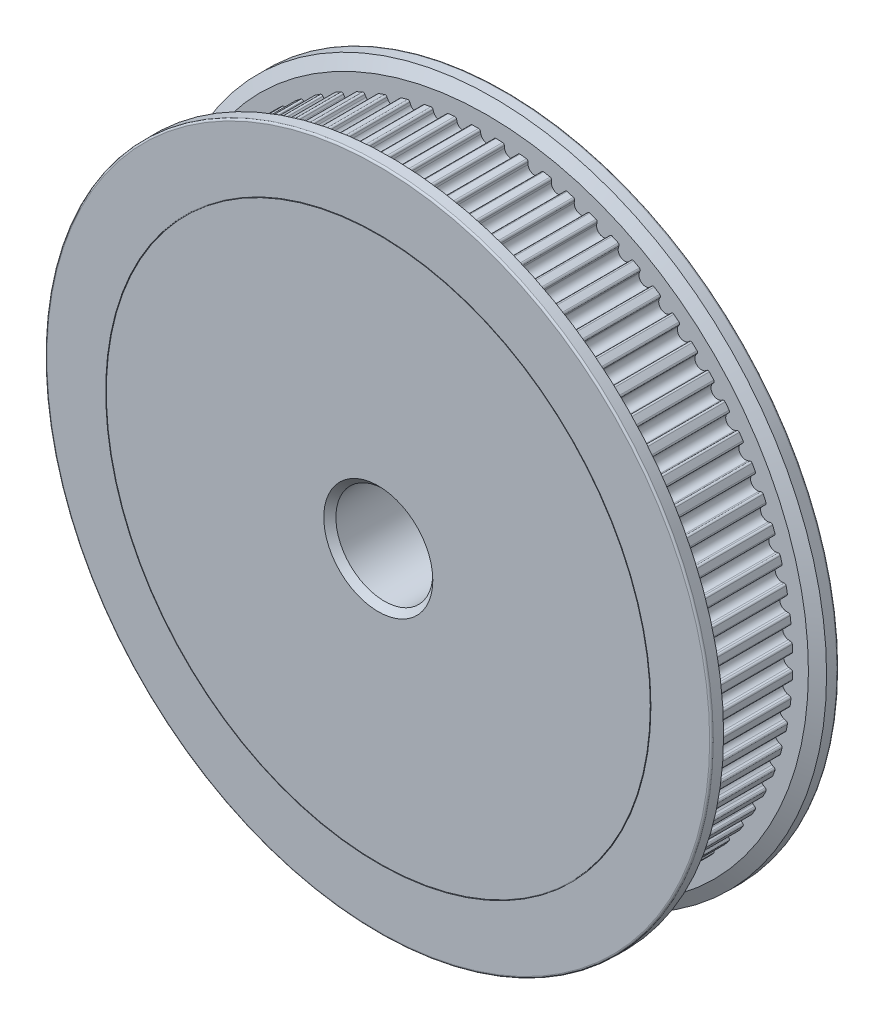
from build123d import *

# Parameters (mm, degrees)
SKETCH1_R           = 15
BOSS_EXTRUDE1_DEPTH = 6.7
SKETCH2_R           = 27.5
BOSS_EXTRUDE2_DEPTH = 1.5
SKETCH3_R           = 25.2
BOSS_EXTRUDE3_DEPTH = 7.5
SKETCH4_R           = 27.5
BOSS_EXTRUDE4_DEPTH = 1.5
CUT_EXTRUDE1_DEPTH  = 7.5
CHAMFER1_SIZE       = 0.5
CHAMFER1_SIZE2      = 1
CHAMFER2_SIZE       = 1
CHAMFER2_SIZE2      = 0.5
SKETCH7_R           = 4
CUT_EXTRUDE2_DEPTH  = 43.524581127
SKETCH8_R           = 22.5
SKETCH8_R_2         = 22.45
CUT_EXTRUDE3_DEPTH  = 0.1
CHAMFER3_SIZE       = 0.5
FILLET1_R           = 0.3
FILLET2_R           = 0.15
SKETCH10_R          = 2.15
CUT_EXTRUDE4_DEPTH  = 43.524581232
CIRPATTERN1_COUNT   = 2
CIRPATTERN1_ANGLE   = 90


with BuildPart() as part:
    # Sketch1 → Boss-Extrude1 (new body)
    with BuildSketch(Plane.XY):
        Circle(SKETCH1_R)
    extrude(amount=BOSS_EXTRUDE1_DEPTH)

    # Sketch2 → Boss-Extrude2 (add)
    with BuildSketch(Plane.XY.offset(6.7)):
        Circle(SKETCH2_R)
    extrude(amount=BOSS_EXTRUDE2_DEPTH)

    # Sketch3 → Boss-Extrude3 (add)
    with BuildSketch(Plane.XY.offset(8.2)):
        Circle(SKETCH3_R)
    extrude(amount=BOSS_EXTRUDE3_DEPTH)

    # Sketch4 → Boss-Extrude4 (add)
    with BuildSketch(Plane.XY.offset(15.7)):
        Circle(SKETCH4_R)
    extrude(amount=BOSS_EXTRUDE4_DEPTH)

    # Sketch5 → Cut-Extrude1 (cut)
    with BuildSketch(Plane.XY.offset(8.2)):
        with BuildLine():
            Line((25.189715552, 0.719882209), (25.785529714, 0.719882209))
            Line((25.785529714, 0.719882209), (25.785529714, -0.719882209))
            Line((25.785529714, -0.719882209), (25.189715552, -0.719882209))
            ThreePointArc((25.189715552, -0.719882209), (25.150400207, -0.61429342), (25.048670191, -0.565861071))
            ThreePointArc((25.048670191, -0.565861071), (24.958222291, -0.556205763), (24.869080789, -0.538099404))
            ThreePointArc((24.869080789, -0.538099404), (24.45, 0), (24.869080789, 0.538099404))
            ThreePointArc((24.869080789, 0.538099404), (24.958222291, 0.556205763), (25.048670191, 0.565861071))
            ThreePointArc((25.048670191, 0.565861071), (25.150400207, 0.61429342), (25.189715552, 0.719882209))
        make_face()
        with BuildLine():
            Line((25.168545373, -1.258699251), (25.762522838, -1.305446292))
            Line((25.762522838, -1.305446292), (25.649560224, -2.740772397))
            Line((25.649560224, -2.740772397), (25.055582759, -2.694025356))
            ThreePointArc((25.055582759, -2.694025356), (25.024673011, -2.585677416), (24.927056552, -2.529412723))
            ThreePointArc((24.927056552, -2.529412723), (24.83764502, -2.512690718), (24.75019892, -2.487646213))
            ThreePointArc((24.75019892, -2.487646213), (24.37462881, -1.918324891), (24.834636505, -1.414764968))
            ThreePointArc((24.834636505, -1.414764968), (24.924923822, -1.403708386), (25.015850448, -1.401179302))
            ThreePointArc((25.015850448, -1.401179302), (25.121066823, -1.360877899), (25.168545373, -1.258699251))
        make_face()
        with BuildLine():
            Line((24.992202742, -3.229520412), (25.580681443, -3.322726282))
            Line((25.580681443, -3.322726282), (25.355452666, -4.744764811))
            Line((25.355452666, -4.744764811), (24.766973966, -4.651558942))
            ThreePointArc((24.766973966, -4.651558942), (24.744660383, -4.541119851), (24.651759321, -4.477369704))
            ThreePointArc((24.651759321, -4.477369704), (24.563935408, -4.453684099), (24.478723845, -4.421855856))
            ThreePointArc((24.478723845, -4.421855856), (24.148979928, -3.82482267), (24.647078429, -3.358906842))
            ThreePointArc((24.647078429, -3.358906842), (24.73795491, -3.354968206), (24.828799669, -3.359580939))
            ThreePointArc((24.828799669, -3.359580939), (24.936853709, -3.327658953), (24.992202742, -3.229520412))
        make_face()
        with BuildLine():
            Line((24.661774871, -5.180430506), (25.241126639, -5.31952056))
            Line((25.241126639, -5.31952056), (24.905020311, -6.719504173))
            Line((24.905020311, -6.719504173), (24.325668542, -6.580414119))
            ThreePointArc((24.325668542, -6.580414119), (24.312088696, -6.468564772), (24.224475796, -6.397722212))
            ThreePointArc((24.224475796, -6.397722212), (24.138780966, -6.367219037), (24.056329296, -6.328803288))
            ThreePointArc((24.056329296, -6.328803288), (23.774444554, -5.707739146), (24.307562919, -5.282339939))
            ThreePointArc((24.307562919, -5.282339939), (24.398468279, -5.285543531), (24.488671083, -5.297269642))
            ThreePointArc((24.488671083, -5.297269642), (24.598896599, -5.273923883), (24.661774871, -5.180430506))
        make_face()
        with BuildLine():
            Line((24.179298956, -7.099401523), (24.745951897, -7.283518224))
            Line((24.745951897, -7.283518224), (24.301040224, -8.652815557))
            Line((24.301040224, -8.652815557), (23.734387283, -8.468698855))
            ThreePointArc((23.734387283, -8.468698855), (23.729624898, -8.35612884), (23.647840322, -8.278630635))
            ThreePointArc((23.647840322, -8.278630635), (23.564802912, -8.241497952), (23.485619479, -8.196731543))
            ThreePointArc((23.485619479, -8.196731543), (23.253331823, -7.555465512), (23.818183199, -7.173205654))
            ThreePointArc((23.818183199, -7.173205654), (23.908556978, -7.183531722), (23.997561697, -7.202298916))
            ThreePointArc((23.997561697, -7.202298916), (24.109279111, -7.187673319), (24.179298956, -7.099401523))
        make_face()
        with BuildLine():
            Line((23.547749623, -8.974602369), (24.098210132, -9.202610577))
            Line((24.098210132, -9.202610577), (23.547236143, -10.532779455))
            Line((23.547236143, -10.532779455), (22.996775634, -10.304771247))
            ThreePointArc((22.996775634, -10.304771247), (23.000860071, -10.192174595), (22.925408049, -10.108498547))
            ThreePointArc((22.925408049, -10.108498547), (22.845540012, -10.064965292), (22.770113007, -10.014124222))
            ThreePointArc((22.770113007, -10.014124222), (22.58885457, -9.356609921), (23.18195646, -9.019846171))
            ThreePointArc((23.18195646, -9.019846171), (23.271241473, -9.037231052), (23.358499363, -9.062923623))
            ThreePointArc((23.358499363, -9.062923623), (23.471019901, -9.057108359), (23.547749623, -8.974602369))
        make_face()
        with BuildLine():
            Line((22.771020583, -10.794471807), (23.301894888, -11.064965776))
            Line((23.301894888, -11.064965776), (22.648255521, -12.347805266))
            Line((22.648255521, -12.347805266), (22.117381216, -12.077311297))
            ThreePointArc((22.117381216, -12.077311297), (22.130287294, -11.965382204), (22.061633012, -11.876044204))
            ThreePointArc((22.061633012, -11.876044204), (21.985426761, -11.826378774), (21.914221217, -11.769776495))
            ThreePointArc((21.914221217, -11.769776495), (21.785109516, -11.100067719), (22.402805251, -10.810876336))
            ThreePointArc((22.402805251, -10.810876336), (22.490451026, -10.835212847), (22.575424113, -10.867672392))
            ThreePointArc((22.575424113, -10.867672392), (22.688054048, -10.870703313), (22.771020583, -10.794471807))
        make_face()
        with BuildLine():
            Line((21.85390063, -12.547789737), (22.361915714, -12.859101781))
            Line((22.361915714, -12.859101781), (21.609640872, -14.086702751))
            Line((21.609640872, -14.086702751), (21.101625787, -13.775390707))
            ThreePointArc((21.101625787, -13.775390707), (21.123273936, -13.664819253), (21.061840671, -13.5703701))
            ThreePointArc((21.061840671, -13.5703701), (20.989766043, -13.514878698), (20.923220965, -13.452864182))
            ThreePointArc((20.923220965, -13.452864182), (20.847052018, -12.775089907), (21.485533298, -12.535253854))
            ThreePointArc((21.485533298, -12.535253854), (21.570999469, -12.566391952), (21.653163866, -12.605418346))
            ThreePointArc((21.653163866, -12.605418346), (21.765208797, -12.617276767), (21.85390063, -12.547789737))
        make_face()
        with BuildLine():
            Line((20.802044111, -14.22374637), (21.284067893, -14.573957147))
            Line((21.284067893, -14.573957147), (20.437795601, -15.738751029))
            Line((20.437795601, -15.738751029), (19.955771819, -15.388540252))
            ThreePointArc((19.955771819, -15.388540252), (19.98602857, -15.280008148), (19.932195078, -15.181030151))
            ThreePointArc((19.932195078, -15.181030151), (19.864696438, -15.120054901), (19.803222099, -15.053010488))
            ThreePointArc((19.803222099, -15.053010488), (19.780465512, -14.371349419), (20.435795887, -14.182347364))
            ThreePointArc((20.435795887, -14.182347364), (20.518555527, -14.220095072), (20.597404664, -14.265447705))
            ThreePointArc((20.597404664, -14.265447705), (20.708173796, -14.286060514), (20.802044111, -14.22374637))
        make_face()
        with BuildLine():
            Line((19.621936074, -15.812008877), (20.074996716, -16.198959221))
            Line((20.074996716, -16.198959221), (19.139944525, -17.293764674))
            Line((19.139944525, -17.293764674), (18.686883882, -16.90681433))
            ThreePointArc((18.686883882, -16.90681433), (18.725562692, -16.800990711), (18.679660875, -16.698094103))
            ThreePointArc((18.679660875, -16.698094103), (18.617154374, -16.632010937), (18.561129784, -16.560349979))
            ThreePointArc((18.561129784, -16.560349979), (18.591925859, -15.879004782), (19.260064999, -15.742001986))
            ThreePointArc((19.260064999, -15.742001986), (19.339607868, -15.786126577), (19.414655612, -15.837525834))
            ThreePointArc((19.414655612, -15.837525834), (19.523466018, -15.866765948), (19.621936074, -15.812008877))
        make_face()
        with BuildLine():
            Line((18.320852275, -17.302785091), (18.742156509, -17.724089325))
            Line((18.742156509, -17.724089325), (17.724089325, -18.742156509))
            Line((17.724089325, -18.742156509), (17.302785091, -18.320852275))
            ThreePointArc((17.302785091, -18.320852275), (17.349647493, -18.218389579), (17.311960351, -18.112208753))
            ThreePointArc((17.311960351, -18.112208753), (17.254831362, -18.041425095), (17.204601931, -17.965589405))
            ThreePointArc((17.204601931, -17.965589405), (17.2887608, -17.2887608), (17.965589405, -17.204601931))
            ThreePointArc((17.965589405, -17.204601931), (18.041425095, -17.254831362), (18.112208753, -17.311960351))
            ThreePointArc((18.112208753, -17.311960351), (18.218389579, -17.349647493), (18.320852275, -17.302785091))
        make_face()
        with BuildLine():
            Line((16.90681433, -18.686883882), (17.293764674, -19.139944525))
            Line((17.293764674, -19.139944525), (16.198959221, -20.074996716))
            Line((16.198959221, -20.074996716), (15.812008877, -19.621936074))
            ThreePointArc((15.812008877, -19.621936074), (15.866765948, -19.523466018), (15.837525834, -19.414655612))
            ThreePointArc((15.837525834, -19.414655612), (15.786126577, -19.339607868), (15.742001986, -19.260064999))
            ThreePointArc((15.742001986, -19.260064999), (15.879004782, -18.591925859), (16.560349979, -18.561129784))
            ThreePointArc((16.560349979, -18.561129784), (16.632010937, -18.617154374), (16.698094103, -18.679660875))
            ThreePointArc((16.698094103, -18.679660875), (16.800990711, -18.725562692), (16.90681433, -18.686883882))
        make_face()
        with BuildLine():
            Line((15.388540252, -19.955771819), (15.738751029, -20.437795601))
            Line((15.738751029, -20.437795601), (14.573957147, -21.284067893))
            Line((14.573957147, -21.284067893), (14.22374637, -20.802044111))
            ThreePointArc((14.22374637, -20.802044111), (14.286060514, -20.708173796), (14.265447705, -20.597404664))
            ThreePointArc((14.265447705, -20.597404664), (14.220095072, -20.518555527), (14.182347364, -20.435795887))
            ThreePointArc((14.182347364, -20.435795887), (14.371349419, -19.780465512), (15.053010488, -19.803222099))
            ThreePointArc((15.053010488, -19.803222099), (15.120054901, -19.864696438), (15.181030151, -19.932195078))
            ThreePointArc((15.181030151, -19.932195078), (15.280008148, -19.98602857), (15.388540252, -19.955771819))
        make_face()
        with BuildLine():
            Line((13.775390707, -21.101625787), (14.086702751, -21.609640872))
            Line((14.086702751, -21.609640872), (12.859101781, -22.361915714))
            Line((12.859101781, -22.361915714), (12.547789737, -21.85390063))
            ThreePointArc((12.547789737, -21.85390063), (12.617276767, -21.765208797), (12.605418346, -21.653163866))
            ThreePointArc((12.605418346, -21.653163866), (12.566391952, -21.570999469), (12.535253854, -21.485533298))
            ThreePointArc((12.535253854, -21.485533298), (12.775089907, -20.847052018), (13.452864182, -20.923220965))
            ThreePointArc((13.452864182, -20.923220965), (13.514878698, -20.989766043), (13.5703701, -21.061840671))
            ThreePointArc((13.5703701, -21.061840671), (13.664819253, -21.123273936), (13.775390707, -21.101625787))
        make_face()
        with BuildLine():
            Line((12.077311297, -22.117381216), (12.347805266, -22.648255521))
            Line((12.347805266, -22.648255521), (11.064965776, -23.301894888))
            Line((11.064965776, -23.301894888), (10.794471807, -22.771020583))
            ThreePointArc((10.794471807, -22.771020583), (10.870703313, -22.688054048), (10.867672392, -22.575424113))
            ThreePointArc((10.867672392, -22.575424113), (10.835212847, -22.490451026), (10.810876336, -22.402805251))
            ThreePointArc((10.810876336, -22.402805251), (11.100067719, -21.785109516), (11.769776495, -21.914221217))
            ThreePointArc((11.769776495, -21.914221217), (11.826378774, -21.985426761), (11.876044204, -22.061633012))
            ThreePointArc((11.876044204, -22.061633012), (11.965382204, -22.130287294), (12.077311297, -22.117381216))
        make_face()
        with BuildLine():
            Line((10.304771247, -22.996775634), (10.532779455, -23.547236143))
            Line((10.532779455, -23.547236143), (9.202610577, -24.098210132))
            Line((9.202610577, -24.098210132), (8.974602369, -23.547749623))
            ThreePointArc((8.974602369, -23.547749623), (9.057108359, -23.471019901), (9.062923623, -23.358499363))
            ThreePointArc((9.062923623, -23.358499363), (9.037231052, -23.271241473), (9.019846171, -23.18195646))
            ThreePointArc((9.019846171, -23.18195646), (9.356609921, -22.58885457), (10.014124222, -22.770113007))
            ThreePointArc((10.014124222, -22.770113007), (10.064965292, -22.845540012), (10.108498547, -22.925408049))
            ThreePointArc((10.108498547, -22.925408049), (10.192174595, -23.000860071), (10.304771247, -22.996775634))
        make_face()
        with BuildLine():
            Line((8.468698855, -23.734387283), (8.652815557, -24.301040224))
            Line((8.652815557, -24.301040224), (7.283518224, -24.745951897))
            Line((7.283518224, -24.745951897), (7.099401523, -24.179298956))
            ThreePointArc((7.099401523, -24.179298956), (7.187673319, -24.109279111), (7.202298916, -23.997561697))
            ThreePointArc((7.202298916, -23.997561697), (7.183531722, -23.908556978), (7.173205654, -23.818183199))
            ThreePointArc((7.173205654, -23.818183199), (7.555465512, -23.253331823), (8.196731543, -23.485619479))
            ThreePointArc((8.196731543, -23.485619479), (8.241497952, -23.564802912), (8.278630635, -23.647840322))
            ThreePointArc((8.278630635, -23.647840322), (8.35612884, -23.729624898), (8.468698855, -23.734387283))
        make_face()
        with BuildLine():
            Line((6.580414119, -24.325668542), (6.719504173, -24.905020311))
            Line((6.719504173, -24.905020311), (5.31952056, -25.241126639))
            Line((5.31952056, -25.241126639), (5.180430506, -24.661774871))
            ThreePointArc((5.180430506, -24.661774871), (5.273923883, -24.598896599), (5.297269642, -24.488671083))
            ThreePointArc((5.297269642, -24.488671083), (5.285543531, -24.398468279), (5.282339939, -24.307562919))
            ThreePointArc((5.282339939, -24.307562919), (5.707739146, -23.774444554), (6.328803288, -24.056329296))
            ThreePointArc((6.328803288, -24.056329296), (6.367219037, -24.138780966), (6.397722212, -24.224475796))
            ThreePointArc((6.397722212, -24.224475796), (6.468564772, -24.312088696), (6.580414119, -24.325668542))
        make_face()
        with BuildLine():
            Line((4.651558942, -24.766973966), (4.744764811, -25.355452666))
            Line((4.744764811, -25.355452666), (3.322726282, -25.580681443))
            Line((3.322726282, -25.580681443), (3.229520412, -24.992202742))
            ThreePointArc((3.229520412, -24.992202742), (3.327658953, -24.936853709), (3.359580939, -24.828799669))
            ThreePointArc((3.359580939, -24.828799669), (3.354968206, -24.73795491), (3.358906842, -24.647078429))
            ThreePointArc((3.358906842, -24.647078429), (3.82482267, -24.148979928), (4.421855856, -24.478723845))
            ThreePointArc((4.421855856, -24.478723845), (4.453684099, -24.563935408), (4.477369704, -24.651759321))
            ThreePointArc((4.477369704, -24.651759321), (4.541119851, -24.744660383), (4.651558942, -24.766973966))
        make_face()
        with BuildLine():
            Line((2.694025356, -25.055582759), (2.740772397, -25.649560224))
            Line((2.740772397, -25.649560224), (1.305446292, -25.762522838))
            Line((1.305446292, -25.762522838), (1.258699251, -25.168545373))
            ThreePointArc((1.258699251, -25.168545373), (1.360877899, -25.121066823), (1.401179302, -25.015850448))
            ThreePointArc((1.401179302, -25.015850448), (1.403708386, -24.924923822), (1.414764968, -24.834636505))
            ThreePointArc((1.414764968, -24.834636505), (1.918324891, -24.37462881), (2.487646213, -24.75019892))
            ThreePointArc((2.487646213, -24.75019892), (2.512690718, -24.83764502), (2.529412723, -24.927056552))
            ThreePointArc((2.529412723, -24.927056552), (2.585677416, -25.024673011), (2.694025356, -25.055582759))
        make_face()
        with BuildLine():
            Line((0.719882209, -25.189715552), (0.719882209, -25.785529714))
            Line((0.719882209, -25.785529714), (-0.719882209, -25.785529714))
            Line((-0.719882209, -25.785529714), (-0.719882209, -25.189715552))
            ThreePointArc((-0.719882209, -25.189715552), (-0.61429342, -25.150400207), (-0.565861071, -25.048670191))
            ThreePointArc((-0.565861071, -25.048670191), (-0.556205763, -24.958222291), (-0.538099404, -24.869080789))
            ThreePointArc((-0.538099404, -24.869080789), (0, -24.45), (0.538099404, -24.869080789))
            ThreePointArc((0.538099404, -24.869080789), (0.556205763, -24.958222291), (0.565861071, -25.048670191))
            ThreePointArc((0.565861071, -25.048670191), (0.61429342, -25.150400207), (0.719882209, -25.189715552))
        make_face()
        with BuildLine():
            Line((-1.258699251, -25.168545373), (-1.305446292, -25.762522838))
            Line((-1.305446292, -25.762522838), (-2.740772397, -25.649560224))
            Line((-2.740772397, -25.649560224), (-2.694025356, -25.055582759))
            ThreePointArc((-2.694025356, -25.055582759), (-2.585677416, -25.024673011), (-2.529412723, -24.927056552))
            ThreePointArc((-2.529412723, -24.927056552), (-2.512690718, -24.83764502), (-2.487646213, -24.75019892))
            ThreePointArc((-2.487646213, -24.75019892), (-1.918324891, -24.37462881), (-1.414764968, -24.834636505))
            ThreePointArc((-1.414764968, -24.834636505), (-1.403708386, -24.924923822), (-1.401179302, -25.015850448))
            ThreePointArc((-1.401179302, -25.015850448), (-1.360877899, -25.121066823), (-1.258699251, -25.168545373))
        make_face()
        with BuildLine():
            Line((-3.229520412, -24.992202742), (-3.322726282, -25.580681443))
            Line((-3.322726282, -25.580681443), (-4.744764811, -25.355452666))
            Line((-4.744764811, -25.355452666), (-4.651558942, -24.766973966))
            ThreePointArc((-4.651558942, -24.766973966), (-4.541119851, -24.744660383), (-4.477369704, -24.651759321))
            ThreePointArc((-4.477369704, -24.651759321), (-4.453684099, -24.563935408), (-4.421855856, -24.478723845))
            ThreePointArc((-4.421855856, -24.478723845), (-3.82482267, -24.148979928), (-3.358906842, -24.647078429))
            ThreePointArc((-3.358906842, -24.647078429), (-3.354968206, -24.73795491), (-3.359580939, -24.828799669))
            ThreePointArc((-3.359580939, -24.828799669), (-3.327658953, -24.936853709), (-3.229520412, -24.992202742))
        make_face()
        with BuildLine():
            Line((-5.180430506, -24.661774871), (-5.31952056, -25.241126639))
            Line((-5.31952056, -25.241126639), (-6.719504173, -24.905020311))
            Line((-6.719504173, -24.905020311), (-6.580414119, -24.325668542))
            ThreePointArc((-6.580414119, -24.325668542), (-6.468564772, -24.312088696), (-6.397722212, -24.224475796))
            ThreePointArc((-6.397722212, -24.224475796), (-6.367219037, -24.138780966), (-6.328803288, -24.056329296))
            ThreePointArc((-6.328803288, -24.056329296), (-5.707739146, -23.774444554), (-5.282339939, -24.307562919))
            ThreePointArc((-5.282339939, -24.307562919), (-5.285543531, -24.398468279), (-5.297269642, -24.488671083))
            ThreePointArc((-5.297269642, -24.488671083), (-5.273923883, -24.598896599), (-5.180430506, -24.661774871))
        make_face()
        with BuildLine():
            Line((-7.099401523, -24.179298956), (-7.283518224, -24.745951897))
            Line((-7.283518224, -24.745951897), (-8.652815557, -24.301040224))
            Line((-8.652815557, -24.301040224), (-8.468698855, -23.734387283))
            ThreePointArc((-8.468698855, -23.734387283), (-8.35612884, -23.729624898), (-8.278630635, -23.647840322))
            ThreePointArc((-8.278630635, -23.647840322), (-8.241497952, -23.564802912), (-8.196731543, -23.485619479))
            ThreePointArc((-8.196731543, -23.485619479), (-7.555465512, -23.253331823), (-7.173205654, -23.818183199))
            ThreePointArc((-7.173205654, -23.818183199), (-7.183531722, -23.908556978), (-7.202298916, -23.997561697))
            ThreePointArc((-7.202298916, -23.997561697), (-7.187673319, -24.109279111), (-7.099401523, -24.179298956))
        make_face()
        with BuildLine():
            Line((-8.974602369, -23.547749623), (-9.202610577, -24.098210132))
            Line((-9.202610577, -24.098210132), (-10.532779455, -23.547236143))
            Line((-10.532779455, -23.547236143), (-10.304771247, -22.996775634))
            ThreePointArc((-10.304771247, -22.996775634), (-10.192174595, -23.000860071), (-10.108498547, -22.925408049))
            ThreePointArc((-10.108498547, -22.925408049), (-10.064965292, -22.845540012), (-10.014124222, -22.770113007))
            ThreePointArc((-10.014124222, -22.770113007), (-9.356609921, -22.58885457), (-9.019846171, -23.18195646))
            ThreePointArc((-9.019846171, -23.18195646), (-9.037231052, -23.271241473), (-9.062923623, -23.358499363))
            ThreePointArc((-9.062923623, -23.358499363), (-9.057108359, -23.471019901), (-8.974602369, -23.547749623))
        make_face()
        with BuildLine():
            Line((-10.794471807, -22.771020583), (-11.064965776, -23.301894888))
            Line((-11.064965776, -23.301894888), (-12.347805266, -22.648255521))
            Line((-12.347805266, -22.648255521), (-12.077311297, -22.117381216))
            ThreePointArc((-12.077311297, -22.117381216), (-11.965382204, -22.130287294), (-11.876044204, -22.061633012))
            ThreePointArc((-11.876044204, -22.061633012), (-11.826378774, -21.985426761), (-11.769776495, -21.914221217))
            ThreePointArc((-11.769776495, -21.914221217), (-11.100067719, -21.785109516), (-10.810876336, -22.402805251))
            ThreePointArc((-10.810876336, -22.402805251), (-10.835212847, -22.490451026), (-10.867672392, -22.575424113))
            ThreePointArc((-10.867672392, -22.575424113), (-10.870703313, -22.688054048), (-10.794471807, -22.771020583))
        make_face()
        with BuildLine():
            Line((-12.547789737, -21.85390063), (-12.859101781, -22.361915714))
            Line((-12.859101781, -22.361915714), (-14.086702751, -21.609640872))
            Line((-14.086702751, -21.609640872), (-13.775390707, -21.101625787))
            ThreePointArc((-13.775390707, -21.101625787), (-13.664819253, -21.123273936), (-13.5703701, -21.061840671))
            ThreePointArc((-13.5703701, -21.061840671), (-13.514878698, -20.989766043), (-13.452864182, -20.923220965))
            ThreePointArc((-13.452864182, -20.923220965), (-12.775089907, -20.847052018), (-12.535253854, -21.485533298))
            ThreePointArc((-12.535253854, -21.485533298), (-12.566391952, -21.570999469), (-12.605418346, -21.653163866))
            ThreePointArc((-12.605418346, -21.653163866), (-12.617276767, -21.765208797), (-12.547789737, -21.85390063))
        make_face()
        with BuildLine():
            Line((-14.22374637, -20.802044111), (-14.573957147, -21.284067893))
            Line((-14.573957147, -21.284067893), (-15.738751029, -20.437795601))
            Line((-15.738751029, -20.437795601), (-15.388540252, -19.955771819))
            ThreePointArc((-15.388540252, -19.955771819), (-15.280008148, -19.98602857), (-15.181030151, -19.932195078))
            ThreePointArc((-15.181030151, -19.932195078), (-15.120054901, -19.864696438), (-15.053010488, -19.803222099))
            ThreePointArc((-15.053010488, -19.803222099), (-14.371349419, -19.780465512), (-14.182347364, -20.435795887))
            ThreePointArc((-14.182347364, -20.435795887), (-14.220095072, -20.518555527), (-14.265447705, -20.597404664))
            ThreePointArc((-14.265447705, -20.597404664), (-14.286060514, -20.708173796), (-14.22374637, -20.802044111))
        make_face()
        with BuildLine():
            Line((-15.812008877, -19.621936074), (-16.198959221, -20.074996716))
            Line((-16.198959221, -20.074996716), (-17.293764674, -19.139944525))
            Line((-17.293764674, -19.139944525), (-16.90681433, -18.686883882))
            ThreePointArc((-16.90681433, -18.686883882), (-16.800990711, -18.725562692), (-16.698094103, -18.679660875))
            ThreePointArc((-16.698094103, -18.679660875), (-16.632010937, -18.617154374), (-16.560349979, -18.561129784))
            ThreePointArc((-16.560349979, -18.561129784), (-15.879004782, -18.591925859), (-15.742001986, -19.260064999))
            ThreePointArc((-15.742001986, -19.260064999), (-15.786126577, -19.339607868), (-15.837525834, -19.414655612))
            ThreePointArc((-15.837525834, -19.414655612), (-15.866765948, -19.523466018), (-15.812008877, -19.621936074))
        make_face()
        with BuildLine():
            Line((-17.302785091, -18.320852275), (-17.724089325, -18.742156509))
            Line((-17.724089325, -18.742156509), (-18.742156509, -17.724089325))
            Line((-18.742156509, -17.724089325), (-18.320852275, -17.302785091))
            ThreePointArc((-18.320852275, -17.302785091), (-18.218389579, -17.349647493), (-18.112208753, -17.311960351))
            ThreePointArc((-18.112208753, -17.311960351), (-18.041425095, -17.254831362), (-17.965589405, -17.204601931))
            ThreePointArc((-17.965589405, -17.204601931), (-17.2887608, -17.2887608), (-17.204601931, -17.965589405))
            ThreePointArc((-17.204601931, -17.965589405), (-17.254831362, -18.041425095), (-17.311960351, -18.112208753))
            ThreePointArc((-17.311960351, -18.112208753), (-17.349647493, -18.218389579), (-17.302785091, -18.320852275))
        make_face()
        with BuildLine():
            Line((-18.686883882, -16.90681433), (-19.139944525, -17.293764674))
            Line((-19.139944525, -17.293764674), (-20.074996716, -16.198959221))
            Line((-20.074996716, -16.198959221), (-19.621936074, -15.812008877))
            ThreePointArc((-19.621936074, -15.812008877), (-19.523466018, -15.866765948), (-19.414655612, -15.837525834))
            ThreePointArc((-19.414655612, -15.837525834), (-19.339607868, -15.786126577), (-19.260064999, -15.742001986))
            ThreePointArc((-19.260064999, -15.742001986), (-18.591925859, -15.879004782), (-18.561129784, -16.560349979))
            ThreePointArc((-18.561129784, -16.560349979), (-18.617154374, -16.632010937), (-18.679660875, -16.698094103))
            ThreePointArc((-18.679660875, -16.698094103), (-18.725562692, -16.800990711), (-18.686883882, -16.90681433))
        make_face()
        with BuildLine():
            Line((-19.955771819, -15.388540252), (-20.437795601, -15.738751029))
            Line((-20.437795601, -15.738751029), (-21.284067893, -14.573957147))
            Line((-21.284067893, -14.573957147), (-20.802044111, -14.22374637))
            ThreePointArc((-20.802044111, -14.22374637), (-20.708173796, -14.286060514), (-20.597404664, -14.265447705))
            ThreePointArc((-20.597404664, -14.265447705), (-20.518555527, -14.220095072), (-20.435795887, -14.182347364))
            ThreePointArc((-20.435795887, -14.182347364), (-19.780465512, -14.371349419), (-19.803222099, -15.053010488))
            ThreePointArc((-19.803222099, -15.053010488), (-19.864696438, -15.120054901), (-19.932195078, -15.181030151))
            ThreePointArc((-19.932195078, -15.181030151), (-19.98602857, -15.280008148), (-19.955771819, -15.388540252))
        make_face()
        with BuildLine():
            Line((-21.101625787, -13.775390707), (-21.609640872, -14.086702751))
            Line((-21.609640872, -14.086702751), (-22.361915714, -12.859101781))
            Line((-22.361915714, -12.859101781), (-21.85390063, -12.547789737))
            ThreePointArc((-21.85390063, -12.547789737), (-21.765208797, -12.617276767), (-21.653163866, -12.605418346))
            ThreePointArc((-21.653163866, -12.605418346), (-21.570999469, -12.566391952), (-21.485533298, -12.535253854))
            ThreePointArc((-21.485533298, -12.535253854), (-20.847052018, -12.775089907), (-20.923220965, -13.452864182))
            ThreePointArc((-20.923220965, -13.452864182), (-20.989766043, -13.514878698), (-21.061840671, -13.5703701))
            ThreePointArc((-21.061840671, -13.5703701), (-21.123273936, -13.664819253), (-21.101625787, -13.775390707))
        make_face()
        with BuildLine():
            Line((-22.117381216, -12.077311297), (-22.648255521, -12.347805266))
            Line((-22.648255521, -12.347805266), (-23.301894888, -11.064965776))
            Line((-23.301894888, -11.064965776), (-22.771020583, -10.794471807))
            ThreePointArc((-22.771020583, -10.794471807), (-22.688054048, -10.870703313), (-22.575424113, -10.867672392))
            ThreePointArc((-22.575424113, -10.867672392), (-22.490451026, -10.835212847), (-22.402805251, -10.810876336))
            ThreePointArc((-22.402805251, -10.810876336), (-21.785109516, -11.100067719), (-21.914221217, -11.769776495))
            ThreePointArc((-21.914221217, -11.769776495), (-21.985426761, -11.826378774), (-22.061633012, -11.876044204))
            ThreePointArc((-22.061633012, -11.876044204), (-22.130287294, -11.965382204), (-22.117381216, -12.077311297))
        make_face()
        with BuildLine():
            Line((-22.996775634, -10.304771247), (-23.547236143, -10.532779455))
            Line((-23.547236143, -10.532779455), (-24.098210132, -9.202610577))
            Line((-24.098210132, -9.202610577), (-23.547749623, -8.974602369))
            ThreePointArc((-23.547749623, -8.974602369), (-23.471019901, -9.057108359), (-23.358499363, -9.062923623))
            ThreePointArc((-23.358499363, -9.062923623), (-23.271241473, -9.037231052), (-23.18195646, -9.019846171))
            ThreePointArc((-23.18195646, -9.019846171), (-22.58885457, -9.356609921), (-22.770113007, -10.014124222))
            ThreePointArc((-22.770113007, -10.014124222), (-22.845540012, -10.064965292), (-22.925408049, -10.108498547))
            ThreePointArc((-22.925408049, -10.108498547), (-23.000860071, -10.192174595), (-22.996775634, -10.304771247))
        make_face()
        with BuildLine():
            Line((-23.734387283, -8.468698855), (-24.301040224, -8.652815557))
            Line((-24.301040224, -8.652815557), (-24.745951897, -7.283518224))
            Line((-24.745951897, -7.283518224), (-24.179298956, -7.099401523))
            ThreePointArc((-24.179298956, -7.099401523), (-24.109279111, -7.187673319), (-23.997561697, -7.202298916))
            ThreePointArc((-23.997561697, -7.202298916), (-23.908556978, -7.183531722), (-23.818183199, -7.173205654))
            ThreePointArc((-23.818183199, -7.173205654), (-23.253331823, -7.555465512), (-23.485619479, -8.196731543))
            ThreePointArc((-23.485619479, -8.196731543), (-23.564802912, -8.241497952), (-23.647840322, -8.278630635))
            ThreePointArc((-23.647840322, -8.278630635), (-23.729624898, -8.35612884), (-23.734387283, -8.468698855))
        make_face()
        with BuildLine():
            Line((-24.325668542, -6.580414119), (-24.905020311, -6.719504173))
            Line((-24.905020311, -6.719504173), (-25.241126639, -5.31952056))
            Line((-25.241126639, -5.31952056), (-24.661774871, -5.180430506))
            ThreePointArc((-24.661774871, -5.180430506), (-24.598896599, -5.273923883), (-24.488671083, -5.297269642))
            ThreePointArc((-24.488671083, -5.297269642), (-24.398468279, -5.285543531), (-24.307562919, -5.282339939))
            ThreePointArc((-24.307562919, -5.282339939), (-23.774444554, -5.707739146), (-24.056329296, -6.328803288))
            ThreePointArc((-24.056329296, -6.328803288), (-24.138780966, -6.367219037), (-24.224475796, -6.397722212))
            ThreePointArc((-24.224475796, -6.397722212), (-24.312088696, -6.468564772), (-24.325668542, -6.580414119))
        make_face()
        with BuildLine():
            Line((-24.766973966, -4.651558942), (-25.355452666, -4.744764811))
            Line((-25.355452666, -4.744764811), (-25.580681443, -3.322726282))
            Line((-25.580681443, -3.322726282), (-24.992202742, -3.229520412))
            ThreePointArc((-24.992202742, -3.229520412), (-24.936853709, -3.327658953), (-24.828799669, -3.359580939))
            ThreePointArc((-24.828799669, -3.359580939), (-24.73795491, -3.354968206), (-24.647078429, -3.358906842))
            ThreePointArc((-24.647078429, -3.358906842), (-24.148979928, -3.82482267), (-24.478723845, -4.421855856))
            ThreePointArc((-24.478723845, -4.421855856), (-24.563935408, -4.453684099), (-24.651759321, -4.477369704))
            ThreePointArc((-24.651759321, -4.477369704), (-24.744660383, -4.541119851), (-24.766973966, -4.651558942))
        make_face()
        with BuildLine():
            Line((-25.055582759, -2.694025356), (-25.649560224, -2.740772397))
            Line((-25.649560224, -2.740772397), (-25.762522838, -1.305446292))
            Line((-25.762522838, -1.305446292), (-25.168545373, -1.258699251))
            ThreePointArc((-25.168545373, -1.258699251), (-25.121066823, -1.360877899), (-25.015850448, -1.401179302))
            ThreePointArc((-25.015850448, -1.401179302), (-24.924923822, -1.403708386), (-24.834636505, -1.414764968))
            ThreePointArc((-24.834636505, -1.414764968), (-24.37462881, -1.918324891), (-24.75019892, -2.487646213))
            ThreePointArc((-24.75019892, -2.487646213), (-24.83764502, -2.512690718), (-24.927056552, -2.529412723))
            ThreePointArc((-24.927056552, -2.529412723), (-25.024673011, -2.585677416), (-25.055582759, -2.694025356))
        make_face()
        with BuildLine():
            Line((-25.189715552, -0.719882209), (-25.785529714, -0.719882209))
            Line((-25.785529714, -0.719882209), (-25.785529714, 0.719882209))
            Line((-25.785529714, 0.719882209), (-25.189715552, 0.719882209))
            ThreePointArc((-25.189715552, 0.719882209), (-25.150400207, 0.61429342), (-25.048670191, 0.565861071))
            ThreePointArc((-25.048670191, 0.565861071), (-24.958222291, 0.556205763), (-24.869080789, 0.538099404))
            ThreePointArc((-24.869080789, 0.538099404), (-24.45, 0), (-24.869080789, -0.538099404))
            ThreePointArc((-24.869080789, -0.538099404), (-24.958222291, -0.556205763), (-25.048670191, -0.565861071))
            ThreePointArc((-25.048670191, -0.565861071), (-25.150400207, -0.61429342), (-25.189715552, -0.719882209))
        make_face()
        with BuildLine():
            Line((-25.168545373, 1.258699251), (-25.762522838, 1.305446292))
            Line((-25.762522838, 1.305446292), (-25.649560224, 2.740772397))
            Line((-25.649560224, 2.740772397), (-25.055582759, 2.694025356))
            ThreePointArc((-25.055582759, 2.694025356), (-25.024673011, 2.585677416), (-24.927056552, 2.529412723))
            ThreePointArc((-24.927056552, 2.529412723), (-24.83764502, 2.512690718), (-24.75019892, 2.487646213))
            ThreePointArc((-24.75019892, 2.487646213), (-24.37462881, 1.918324891), (-24.834636505, 1.414764968))
            ThreePointArc((-24.834636505, 1.414764968), (-24.924923822, 1.403708386), (-25.015850448, 1.401179302))
            ThreePointArc((-25.015850448, 1.401179302), (-25.121066823, 1.360877899), (-25.168545373, 1.258699251))
        make_face()
        with BuildLine():
            Line((-24.992202742, 3.229520412), (-25.580681443, 3.322726282))
            Line((-25.580681443, 3.322726282), (-25.355452666, 4.744764811))
            Line((-25.355452666, 4.744764811), (-24.766973966, 4.651558942))
            ThreePointArc((-24.766973966, 4.651558942), (-24.744660383, 4.541119851), (-24.651759321, 4.477369704))
            ThreePointArc((-24.651759321, 4.477369704), (-24.563935408, 4.453684099), (-24.478723845, 4.421855856))
            ThreePointArc((-24.478723845, 4.421855856), (-24.148979928, 3.82482267), (-24.647078429, 3.358906842))
            ThreePointArc((-24.647078429, 3.358906842), (-24.73795491, 3.354968206), (-24.828799669, 3.359580939))
            ThreePointArc((-24.828799669, 3.359580939), (-24.936853709, 3.327658953), (-24.992202742, 3.229520412))
        make_face()
        with BuildLine():
            Line((-24.661774871, 5.180430506), (-25.241126639, 5.31952056))
            Line((-25.241126639, 5.31952056), (-24.905020311, 6.719504173))
            Line((-24.905020311, 6.719504173), (-24.325668542, 6.580414119))
            ThreePointArc((-24.325668542, 6.580414119), (-24.312088696, 6.468564772), (-24.224475796, 6.397722212))
            ThreePointArc((-24.224475796, 6.397722212), (-24.138780966, 6.367219037), (-24.056329296, 6.328803288))
            ThreePointArc((-24.056329296, 6.328803288), (-23.774444554, 5.707739146), (-24.307562919, 5.282339939))
            ThreePointArc((-24.307562919, 5.282339939), (-24.398468279, 5.285543531), (-24.488671083, 5.297269642))
            ThreePointArc((-24.488671083, 5.297269642), (-24.598896599, 5.273923883), (-24.661774871, 5.180430506))
        make_face()
        with BuildLine():
            Line((-24.179298956, 7.099401523), (-24.745951897, 7.283518224))
            Line((-24.745951897, 7.283518224), (-24.301040224, 8.652815557))
            Line((-24.301040224, 8.652815557), (-23.734387283, 8.468698855))
            ThreePointArc((-23.734387283, 8.468698855), (-23.729624898, 8.35612884), (-23.647840322, 8.278630635))
            ThreePointArc((-23.647840322, 8.278630635), (-23.564802912, 8.241497952), (-23.485619479, 8.196731543))
            ThreePointArc((-23.485619479, 8.196731543), (-23.253331823, 7.555465512), (-23.818183199, 7.173205654))
            ThreePointArc((-23.818183199, 7.173205654), (-23.908556978, 7.183531722), (-23.997561697, 7.202298916))
            ThreePointArc((-23.997561697, 7.202298916), (-24.109279111, 7.187673319), (-24.179298956, 7.099401523))
        make_face()
        with BuildLine():
            Line((-23.547749623, 8.974602369), (-24.098210132, 9.202610577))
            Line((-24.098210132, 9.202610577), (-23.547236143, 10.532779455))
            Line((-23.547236143, 10.532779455), (-22.996775634, 10.304771247))
            ThreePointArc((-22.996775634, 10.304771247), (-23.000860071, 10.192174595), (-22.925408049, 10.108498547))
            ThreePointArc((-22.925408049, 10.108498547), (-22.845540012, 10.064965292), (-22.770113007, 10.014124222))
            ThreePointArc((-22.770113007, 10.014124222), (-22.58885457, 9.356609921), (-23.18195646, 9.019846171))
            ThreePointArc((-23.18195646, 9.019846171), (-23.271241473, 9.037231052), (-23.358499363, 9.062923623))
            ThreePointArc((-23.358499363, 9.062923623), (-23.471019901, 9.057108359), (-23.547749623, 8.974602369))
        make_face()
        with BuildLine():
            Line((-22.771020583, 10.794471807), (-23.301894888, 11.064965776))
            Line((-23.301894888, 11.064965776), (-22.648255521, 12.347805266))
            Line((-22.648255521, 12.347805266), (-22.117381216, 12.077311297))
            ThreePointArc((-22.117381216, 12.077311297), (-22.130287294, 11.965382204), (-22.061633012, 11.876044204))
            ThreePointArc((-22.061633012, 11.876044204), (-21.985426761, 11.826378774), (-21.914221217, 11.769776495))
            ThreePointArc((-21.914221217, 11.769776495), (-21.785109516, 11.100067719), (-22.402805251, 10.810876336))
            ThreePointArc((-22.402805251, 10.810876336), (-22.490451026, 10.835212847), (-22.575424113, 10.867672392))
            ThreePointArc((-22.575424113, 10.867672392), (-22.688054048, 10.870703313), (-22.771020583, 10.794471807))
        make_face()
        with BuildLine():
            Line((-21.85390063, 12.547789737), (-22.361915714, 12.859101781))
            Line((-22.361915714, 12.859101781), (-21.609640872, 14.086702751))
            Line((-21.609640872, 14.086702751), (-21.101625787, 13.775390707))
            ThreePointArc((-21.101625787, 13.775390707), (-21.123273936, 13.664819253), (-21.061840671, 13.5703701))
            ThreePointArc((-21.061840671, 13.5703701), (-20.989766043, 13.514878698), (-20.923220965, 13.452864182))
            ThreePointArc((-20.923220965, 13.452864182), (-20.847052018, 12.775089907), (-21.485533298, 12.535253854))
            ThreePointArc((-21.485533298, 12.535253854), (-21.570999469, 12.566391952), (-21.653163866, 12.605418346))
            ThreePointArc((-21.653163866, 12.605418346), (-21.765208797, 12.617276767), (-21.85390063, 12.547789737))
        make_face()
        with BuildLine():
            Line((-20.802044111, 14.22374637), (-21.284067893, 14.573957147))
            Line((-21.284067893, 14.573957147), (-20.437795601, 15.738751029))
            Line((-20.437795601, 15.738751029), (-19.955771819, 15.388540252))
            ThreePointArc((-19.955771819, 15.388540252), (-19.98602857, 15.280008148), (-19.932195078, 15.181030151))
            ThreePointArc((-19.932195078, 15.181030151), (-19.864696438, 15.120054901), (-19.803222099, 15.053010488))
            ThreePointArc((-19.803222099, 15.053010488), (-19.780465512, 14.371349419), (-20.435795887, 14.182347364))
            ThreePointArc((-20.435795887, 14.182347364), (-20.518555527, 14.220095072), (-20.597404664, 14.265447705))
            ThreePointArc((-20.597404664, 14.265447705), (-20.708173796, 14.286060514), (-20.802044111, 14.22374637))
        make_face()
        with BuildLine():
            Line((-19.621936074, 15.812008877), (-20.074996716, 16.198959221))
            Line((-20.074996716, 16.198959221), (-19.139944525, 17.293764674))
            Line((-19.139944525, 17.293764674), (-18.686883882, 16.90681433))
            ThreePointArc((-18.686883882, 16.90681433), (-18.725562692, 16.800990711), (-18.679660875, 16.698094103))
            ThreePointArc((-18.679660875, 16.698094103), (-18.617154374, 16.632010937), (-18.561129784, 16.560349979))
            ThreePointArc((-18.561129784, 16.560349979), (-18.591925859, 15.879004782), (-19.260064999, 15.742001986))
            ThreePointArc((-19.260064999, 15.742001986), (-19.339607868, 15.786126577), (-19.414655612, 15.837525834))
            ThreePointArc((-19.414655612, 15.837525834), (-19.523466018, 15.866765948), (-19.621936074, 15.812008877))
        make_face()
        with BuildLine():
            Line((-18.320852275, 17.302785091), (-18.742156509, 17.724089325))
            Line((-18.742156509, 17.724089325), (-17.724089325, 18.742156509))
            Line((-17.724089325, 18.742156509), (-17.302785091, 18.320852275))
            ThreePointArc((-17.302785091, 18.320852275), (-17.349647493, 18.218389579), (-17.311960351, 18.112208753))
            ThreePointArc((-17.311960351, 18.112208753), (-17.254831362, 18.041425095), (-17.204601931, 17.965589405))
            ThreePointArc((-17.204601931, 17.965589405), (-17.2887608, 17.2887608), (-17.965589405, 17.204601931))
            ThreePointArc((-17.965589405, 17.204601931), (-18.041425095, 17.254831362), (-18.112208753, 17.311960351))
            ThreePointArc((-18.112208753, 17.311960351), (-18.218389579, 17.349647493), (-18.320852275, 17.302785091))
        make_face()
        with BuildLine():
            Line((-16.90681433, 18.686883882), (-17.293764674, 19.139944525))
            Line((-17.293764674, 19.139944525), (-16.198959221, 20.074996716))
            Line((-16.198959221, 20.074996716), (-15.812008877, 19.621936074))
            ThreePointArc((-15.812008877, 19.621936074), (-15.866765948, 19.523466018), (-15.837525834, 19.414655612))
            ThreePointArc((-15.837525834, 19.414655612), (-15.786126577, 19.339607868), (-15.742001986, 19.260064999))
            ThreePointArc((-15.742001986, 19.260064999), (-15.879004782, 18.591925859), (-16.560349979, 18.561129784))
            ThreePointArc((-16.560349979, 18.561129784), (-16.632010937, 18.617154374), (-16.698094103, 18.679660875))
            ThreePointArc((-16.698094103, 18.679660875), (-16.800990711, 18.725562692), (-16.90681433, 18.686883882))
        make_face()
        with BuildLine():
            Line((-15.388540252, 19.955771819), (-15.738751029, 20.437795601))
            Line((-15.738751029, 20.437795601), (-14.573957147, 21.284067893))
            Line((-14.573957147, 21.284067893), (-14.22374637, 20.802044111))
            ThreePointArc((-14.22374637, 20.802044111), (-14.286060514, 20.708173796), (-14.265447705, 20.597404664))
            ThreePointArc((-14.265447705, 20.597404664), (-14.220095072, 20.518555527), (-14.182347364, 20.435795887))
            ThreePointArc((-14.182347364, 20.435795887), (-14.371349419, 19.780465512), (-15.053010488, 19.803222099))
            ThreePointArc((-15.053010488, 19.803222099), (-15.120054901, 19.864696438), (-15.181030151, 19.932195078))
            ThreePointArc((-15.181030151, 19.932195078), (-15.280008148, 19.98602857), (-15.388540252, 19.955771819))
        make_face()
        with BuildLine():
            Line((-13.775390707, 21.101625787), (-14.086702751, 21.609640872))
            Line((-14.086702751, 21.609640872), (-12.859101781, 22.361915714))
            Line((-12.859101781, 22.361915714), (-12.547789737, 21.85390063))
            ThreePointArc((-12.547789737, 21.85390063), (-12.617276767, 21.765208797), (-12.605418346, 21.653163866))
            ThreePointArc((-12.605418346, 21.653163866), (-12.566391952, 21.570999469), (-12.535253854, 21.485533298))
            ThreePointArc((-12.535253854, 21.485533298), (-12.775089907, 20.847052018), (-13.452864182, 20.923220965))
            ThreePointArc((-13.452864182, 20.923220965), (-13.514878698, 20.989766043), (-13.5703701, 21.061840671))
            ThreePointArc((-13.5703701, 21.061840671), (-13.664819253, 21.123273936), (-13.775390707, 21.101625787))
        make_face()
        with BuildLine():
            Line((-12.077311297, 22.117381216), (-12.347805266, 22.648255521))
            Line((-12.347805266, 22.648255521), (-11.064965776, 23.301894888))
            Line((-11.064965776, 23.301894888), (-10.794471807, 22.771020583))
            ThreePointArc((-10.794471807, 22.771020583), (-10.870703313, 22.688054048), (-10.867672392, 22.575424113))
            ThreePointArc((-10.867672392, 22.575424113), (-10.835212847, 22.490451026), (-10.810876336, 22.402805251))
            ThreePointArc((-10.810876336, 22.402805251), (-11.100067719, 21.785109516), (-11.769776495, 21.914221217))
            ThreePointArc((-11.769776495, 21.914221217), (-11.826378774, 21.985426761), (-11.876044204, 22.061633012))
            ThreePointArc((-11.876044204, 22.061633012), (-11.965382204, 22.130287294), (-12.077311297, 22.117381216))
        make_face()
        with BuildLine():
            Line((-10.304771247, 22.996775634), (-10.532779455, 23.547236143))
            Line((-10.532779455, 23.547236143), (-9.202610577, 24.098210132))
            Line((-9.202610577, 24.098210132), (-8.974602369, 23.547749623))
            ThreePointArc((-8.974602369, 23.547749623), (-9.057108359, 23.471019901), (-9.062923623, 23.358499363))
            ThreePointArc((-9.062923623, 23.358499363), (-9.037231052, 23.271241473), (-9.019846171, 23.18195646))
            ThreePointArc((-9.019846171, 23.18195646), (-9.356609921, 22.58885457), (-10.014124222, 22.770113007))
            ThreePointArc((-10.014124222, 22.770113007), (-10.064965292, 22.845540012), (-10.108498547, 22.925408049))
            ThreePointArc((-10.108498547, 22.925408049), (-10.192174595, 23.000860071), (-10.304771247, 22.996775634))
        make_face()
        with BuildLine():
            Line((-8.468698855, 23.734387283), (-8.652815557, 24.301040224))
            Line((-8.652815557, 24.301040224), (-7.283518224, 24.745951897))
            Line((-7.283518224, 24.745951897), (-7.099401523, 24.179298956))
            ThreePointArc((-7.099401523, 24.179298956), (-7.187673319, 24.109279111), (-7.202298916, 23.997561697))
            ThreePointArc((-7.202298916, 23.997561697), (-7.183531722, 23.908556978), (-7.173205654, 23.818183199))
            ThreePointArc((-7.173205654, 23.818183199), (-7.555465512, 23.253331823), (-8.196731543, 23.485619479))
            ThreePointArc((-8.196731543, 23.485619479), (-8.241497952, 23.564802912), (-8.278630635, 23.647840322))
            ThreePointArc((-8.278630635, 23.647840322), (-8.35612884, 23.729624898), (-8.468698855, 23.734387283))
        make_face()
        with BuildLine():
            Line((-6.580414119, 24.325668542), (-6.719504173, 24.905020311))
            Line((-6.719504173, 24.905020311), (-5.31952056, 25.241126639))
            Line((-5.31952056, 25.241126639), (-5.180430506, 24.661774871))
            ThreePointArc((-5.180430506, 24.661774871), (-5.273923883, 24.598896599), (-5.297269642, 24.488671083))
            ThreePointArc((-5.297269642, 24.488671083), (-5.285543531, 24.398468279), (-5.282339939, 24.307562919))
            ThreePointArc((-5.282339939, 24.307562919), (-5.707739146, 23.774444554), (-6.328803288, 24.056329296))
            ThreePointArc((-6.328803288, 24.056329296), (-6.367219037, 24.138780966), (-6.397722212, 24.224475796))
            ThreePointArc((-6.397722212, 24.224475796), (-6.468564772, 24.312088696), (-6.580414119, 24.325668542))
        make_face()
        with BuildLine():
            Line((-4.651558942, 24.766973966), (-4.744764811, 25.355452666))
            Line((-4.744764811, 25.355452666), (-3.322726282, 25.580681443))
            Line((-3.322726282, 25.580681443), (-3.229520412, 24.992202742))
            ThreePointArc((-3.229520412, 24.992202742), (-3.327658953, 24.936853709), (-3.359580939, 24.828799669))
            ThreePointArc((-3.359580939, 24.828799669), (-3.354968206, 24.73795491), (-3.358906842, 24.647078429))
            ThreePointArc((-3.358906842, 24.647078429), (-3.82482267, 24.148979928), (-4.421855856, 24.478723845))
            ThreePointArc((-4.421855856, 24.478723845), (-4.453684099, 24.563935408), (-4.477369704, 24.651759321))
            ThreePointArc((-4.477369704, 24.651759321), (-4.541119851, 24.744660383), (-4.651558942, 24.766973966))
        make_face()
        with BuildLine():
            Line((-2.694025356, 25.055582759), (-2.740772397, 25.649560224))
            Line((-2.740772397, 25.649560224), (-1.305446292, 25.762522838))
            Line((-1.305446292, 25.762522838), (-1.258699251, 25.168545373))
            ThreePointArc((-1.258699251, 25.168545373), (-1.360877899, 25.121066823), (-1.401179302, 25.015850448))
            ThreePointArc((-1.401179302, 25.015850448), (-1.403708386, 24.924923822), (-1.414764968, 24.834636505))
            ThreePointArc((-1.414764968, 24.834636505), (-1.918324891, 24.37462881), (-2.487646213, 24.75019892))
            ThreePointArc((-2.487646213, 24.75019892), (-2.512690718, 24.83764502), (-2.529412723, 24.927056552))
            ThreePointArc((-2.529412723, 24.927056552), (-2.585677416, 25.024673011), (-2.694025356, 25.055582759))
        make_face()
        with BuildLine():
            Line((-0.719882209, 25.189715552), (-0.719882209, 25.785529714))
            Line((-0.719882209, 25.785529714), (0.719882209, 25.785529714))
            Line((0.719882209, 25.785529714), (0.719882209, 25.189715552))
            ThreePointArc((0.719882209, 25.189715552), (0.61429342, 25.150400207), (0.565861071, 25.048670191))
            ThreePointArc((0.565861071, 25.048670191), (0.556205763, 24.958222291), (0.538099404, 24.869080789))
            ThreePointArc((0.538099404, 24.869080789), (0, 24.45), (-0.538099404, 24.869080789))
            ThreePointArc((-0.538099404, 24.869080789), (-0.556205763, 24.958222291), (-0.565861071, 25.048670191))
            ThreePointArc((-0.565861071, 25.048670191), (-0.61429342, 25.150400207), (-0.719882209, 25.189715552))
        make_face()
        with BuildLine():
            Line((1.258699251, 25.168545373), (1.305446292, 25.762522838))
            Line((1.305446292, 25.762522838), (2.740772397, 25.649560224))
            Line((2.740772397, 25.649560224), (2.694025356, 25.055582759))
            ThreePointArc((2.694025356, 25.055582759), (2.585677416, 25.024673011), (2.529412723, 24.927056552))
            ThreePointArc((2.529412723, 24.927056552), (2.512690718, 24.83764502), (2.487646213, 24.75019892))
            ThreePointArc((2.487646213, 24.75019892), (1.918324891, 24.37462881), (1.414764968, 24.834636505))
            ThreePointArc((1.414764968, 24.834636505), (1.403708386, 24.924923822), (1.401179302, 25.015850448))
            ThreePointArc((1.401179302, 25.015850448), (1.360877899, 25.121066823), (1.258699251, 25.168545373))
        make_face()
        with BuildLine():
            Line((3.229520412, 24.992202742), (3.322726282, 25.580681443))
            Line((3.322726282, 25.580681443), (4.744764811, 25.355452666))
            Line((4.744764811, 25.355452666), (4.651558942, 24.766973966))
            ThreePointArc((4.651558942, 24.766973966), (4.541119851, 24.744660383), (4.477369704, 24.651759321))
            ThreePointArc((4.477369704, 24.651759321), (4.453684099, 24.563935408), (4.421855856, 24.478723845))
            ThreePointArc((4.421855856, 24.478723845), (3.82482267, 24.148979928), (3.358906842, 24.647078429))
            ThreePointArc((3.358906842, 24.647078429), (3.354968206, 24.73795491), (3.359580939, 24.828799669))
            ThreePointArc((3.359580939, 24.828799669), (3.327658953, 24.936853709), (3.229520412, 24.992202742))
        make_face()
        with BuildLine():
            Line((5.180430506, 24.661774871), (5.31952056, 25.241126639))
            Line((5.31952056, 25.241126639), (6.719504173, 24.905020311))
            Line((6.719504173, 24.905020311), (6.580414119, 24.325668542))
            ThreePointArc((6.580414119, 24.325668542), (6.468564772, 24.312088696), (6.397722212, 24.224475796))
            ThreePointArc((6.397722212, 24.224475796), (6.367219037, 24.138780966), (6.328803288, 24.056329296))
            ThreePointArc((6.328803288, 24.056329296), (5.707739146, 23.774444554), (5.282339939, 24.307562919))
            ThreePointArc((5.282339939, 24.307562919), (5.285543531, 24.398468279), (5.297269642, 24.488671083))
            ThreePointArc((5.297269642, 24.488671083), (5.273923883, 24.598896599), (5.180430506, 24.661774871))
        make_face()
        with BuildLine():
            Line((7.099401523, 24.179298956), (7.283518224, 24.745951897))
            Line((7.283518224, 24.745951897), (8.652815557, 24.301040224))
            Line((8.652815557, 24.301040224), (8.468698855, 23.734387283))
            ThreePointArc((8.468698855, 23.734387283), (8.35612884, 23.729624898), (8.278630635, 23.647840322))
            ThreePointArc((8.278630635, 23.647840322), (8.241497952, 23.564802912), (8.196731543, 23.485619479))
            ThreePointArc((8.196731543, 23.485619479), (7.555465512, 23.253331823), (7.173205654, 23.818183199))
            ThreePointArc((7.173205654, 23.818183199), (7.183531722, 23.908556978), (7.202298916, 23.997561697))
            ThreePointArc((7.202298916, 23.997561697), (7.187673319, 24.109279111), (7.099401523, 24.179298956))
        make_face()
        with BuildLine():
            Line((8.974602369, 23.547749623), (9.202610577, 24.098210132))
            Line((9.202610577, 24.098210132), (10.532779455, 23.547236143))
            Line((10.532779455, 23.547236143), (10.304771247, 22.996775634))
            ThreePointArc((10.304771247, 22.996775634), (10.192174595, 23.000860071), (10.108498547, 22.925408049))
            ThreePointArc((10.108498547, 22.925408049), (10.064965292, 22.845540012), (10.014124222, 22.770113007))
            ThreePointArc((10.014124222, 22.770113007), (9.356609921, 22.58885457), (9.019846171, 23.18195646))
            ThreePointArc((9.019846171, 23.18195646), (9.037231052, 23.271241473), (9.062923623, 23.358499363))
            ThreePointArc((9.062923623, 23.358499363), (9.057108359, 23.471019901), (8.974602369, 23.547749623))
        make_face()
        with BuildLine():
            Line((10.794471807, 22.771020583), (11.064965776, 23.301894888))
            Line((11.064965776, 23.301894888), (12.347805266, 22.648255521))
            Line((12.347805266, 22.648255521), (12.077311297, 22.117381216))
            ThreePointArc((12.077311297, 22.117381216), (11.965382204, 22.130287294), (11.876044204, 22.061633012))
            ThreePointArc((11.876044204, 22.061633012), (11.826378774, 21.985426761), (11.769776495, 21.914221217))
            ThreePointArc((11.769776495, 21.914221217), (11.100067719, 21.785109516), (10.810876336, 22.402805251))
            ThreePointArc((10.810876336, 22.402805251), (10.835212847, 22.490451026), (10.867672392, 22.575424113))
            ThreePointArc((10.867672392, 22.575424113), (10.870703313, 22.688054048), (10.794471807, 22.771020583))
        make_face()
        with BuildLine():
            Line((12.547789737, 21.85390063), (12.859101781, 22.361915714))
            Line((12.859101781, 22.361915714), (14.086702751, 21.609640872))
            Line((14.086702751, 21.609640872), (13.775390707, 21.101625787))
            ThreePointArc((13.775390707, 21.101625787), (13.664819253, 21.123273936), (13.5703701, 21.061840671))
            ThreePointArc((13.5703701, 21.061840671), (13.514878698, 20.989766043), (13.452864182, 20.923220965))
            ThreePointArc((13.452864182, 20.923220965), (12.775089907, 20.847052018), (12.535253854, 21.485533298))
            ThreePointArc((12.535253854, 21.485533298), (12.566391952, 21.570999469), (12.605418346, 21.653163866))
            ThreePointArc((12.605418346, 21.653163866), (12.617276767, 21.765208797), (12.547789737, 21.85390063))
        make_face()
        with BuildLine():
            Line((14.22374637, 20.802044111), (14.573957147, 21.284067893))
            Line((14.573957147, 21.284067893), (15.738751029, 20.437795601))
            Line((15.738751029, 20.437795601), (15.388540252, 19.955771819))
            ThreePointArc((15.388540252, 19.955771819), (15.280008148, 19.98602857), (15.181030151, 19.932195078))
            ThreePointArc((15.181030151, 19.932195078), (15.120054901, 19.864696438), (15.053010488, 19.803222099))
            ThreePointArc((15.053010488, 19.803222099), (14.371349419, 19.780465512), (14.182347364, 20.435795887))
            ThreePointArc((14.182347364, 20.435795887), (14.220095072, 20.518555527), (14.265447705, 20.597404664))
            ThreePointArc((14.265447705, 20.597404664), (14.286060514, 20.708173796), (14.22374637, 20.802044111))
        make_face()
        with BuildLine():
            Line((15.812008877, 19.621936074), (16.198959221, 20.074996716))
            Line((16.198959221, 20.074996716), (17.293764674, 19.139944525))
            Line((17.293764674, 19.139944525), (16.90681433, 18.686883882))
            ThreePointArc((16.90681433, 18.686883882), (16.800990711, 18.725562692), (16.698094103, 18.679660875))
            ThreePointArc((16.698094103, 18.679660875), (16.632010937, 18.617154374), (16.560349979, 18.561129784))
            ThreePointArc((16.560349979, 18.561129784), (15.879004782, 18.591925859), (15.742001986, 19.260064999))
            ThreePointArc((15.742001986, 19.260064999), (15.786126577, 19.339607868), (15.837525834, 19.414655612))
            ThreePointArc((15.837525834, 19.414655612), (15.866765948, 19.523466018), (15.812008877, 19.621936074))
        make_face()
        with BuildLine():
            Line((17.302785091, 18.320852275), (17.724089325, 18.742156509))
            Line((17.724089325, 18.742156509), (18.742156509, 17.724089325))
            Line((18.742156509, 17.724089325), (18.320852275, 17.302785091))
            ThreePointArc((18.320852275, 17.302785091), (18.218389579, 17.349647493), (18.112208753, 17.311960351))
            ThreePointArc((18.112208753, 17.311960351), (18.041425095, 17.254831362), (17.965589405, 17.204601931))
            ThreePointArc((17.965589405, 17.204601931), (17.2887608, 17.2887608), (17.204601931, 17.965589405))
            ThreePointArc((17.204601931, 17.965589405), (17.254831362, 18.041425095), (17.311960351, 18.112208753))
            ThreePointArc((17.311960351, 18.112208753), (17.349647493, 18.218389579), (17.302785091, 18.320852275))
        make_face()
        with BuildLine():
            Line((18.686883882, 16.90681433), (19.139944525, 17.293764674))
            Line((19.139944525, 17.293764674), (20.074996716, 16.198959221))
            Line((20.074996716, 16.198959221), (19.621936074, 15.812008877))
            ThreePointArc((19.621936074, 15.812008877), (19.523466018, 15.866765948), (19.414655612, 15.837525834))
            ThreePointArc((19.414655612, 15.837525834), (19.339607868, 15.786126577), (19.260064999, 15.742001986))
            ThreePointArc((19.260064999, 15.742001986), (18.591925859, 15.879004782), (18.561129784, 16.560349979))
            ThreePointArc((18.561129784, 16.560349979), (18.617154374, 16.632010937), (18.679660875, 16.698094103))
            ThreePointArc((18.679660875, 16.698094103), (18.725562692, 16.800990711), (18.686883882, 16.90681433))
        make_face()
        with BuildLine():
            Line((19.955771819, 15.388540252), (20.437795601, 15.738751029))
            Line((20.437795601, 15.738751029), (21.284067893, 14.573957147))
            Line((21.284067893, 14.573957147), (20.802044111, 14.22374637))
            ThreePointArc((20.802044111, 14.22374637), (20.708173796, 14.286060514), (20.597404664, 14.265447705))
            ThreePointArc((20.597404664, 14.265447705), (20.518555527, 14.220095072), (20.435795887, 14.182347364))
            ThreePointArc((20.435795887, 14.182347364), (19.780465512, 14.371349419), (19.803222099, 15.053010488))
            ThreePointArc((19.803222099, 15.053010488), (19.864696438, 15.120054901), (19.932195078, 15.181030151))
            ThreePointArc((19.932195078, 15.181030151), (19.98602857, 15.280008148), (19.955771819, 15.388540252))
        make_face()
        with BuildLine():
            Line((21.101625787, 13.775390707), (21.609640872, 14.086702751))
            Line((21.609640872, 14.086702751), (22.361915714, 12.859101781))
            Line((22.361915714, 12.859101781), (21.85390063, 12.547789737))
            ThreePointArc((21.85390063, 12.547789737), (21.765208797, 12.617276767), (21.653163866, 12.605418346))
            ThreePointArc((21.653163866, 12.605418346), (21.570999469, 12.566391952), (21.485533298, 12.535253854))
            ThreePointArc((21.485533298, 12.535253854), (20.847052018, 12.775089907), (20.923220965, 13.452864182))
            ThreePointArc((20.923220965, 13.452864182), (20.989766043, 13.514878698), (21.061840671, 13.5703701))
            ThreePointArc((21.061840671, 13.5703701), (21.123273936, 13.664819253), (21.101625787, 13.775390707))
        make_face()
        with BuildLine():
            Line((22.117381216, 12.077311297), (22.648255521, 12.347805266))
            Line((22.648255521, 12.347805266), (23.301894888, 11.064965776))
            Line((23.301894888, 11.064965776), (22.771020583, 10.794471807))
            ThreePointArc((22.771020583, 10.794471807), (22.688054048, 10.870703313), (22.575424113, 10.867672392))
            ThreePointArc((22.575424113, 10.867672392), (22.490451026, 10.835212847), (22.402805251, 10.810876336))
            ThreePointArc((22.402805251, 10.810876336), (21.785109516, 11.100067719), (21.914221217, 11.769776495))
            ThreePointArc((21.914221217, 11.769776495), (21.985426761, 11.826378774), (22.061633012, 11.876044204))
            ThreePointArc((22.061633012, 11.876044204), (22.130287294, 11.965382204), (22.117381216, 12.077311297))
        make_face()
        with BuildLine():
            Line((22.996775634, 10.304771247), (23.547236143, 10.532779455))
            Line((23.547236143, 10.532779455), (24.098210132, 9.202610577))
            Line((24.098210132, 9.202610577), (23.547749623, 8.974602369))
            ThreePointArc((23.547749623, 8.974602369), (23.471019901, 9.057108359), (23.358499363, 9.062923623))
            ThreePointArc((23.358499363, 9.062923623), (23.271241473, 9.037231052), (23.18195646, 9.019846171))
            ThreePointArc((23.18195646, 9.019846171), (22.58885457, 9.356609921), (22.770113007, 10.014124222))
            ThreePointArc((22.770113007, 10.014124222), (22.845540012, 10.064965292), (22.925408049, 10.108498547))
            ThreePointArc((22.925408049, 10.108498547), (23.000860071, 10.192174595), (22.996775634, 10.304771247))
        make_face()
        with BuildLine():
            Line((23.734387283, 8.468698855), (24.301040224, 8.652815557))
            Line((24.301040224, 8.652815557), (24.745951897, 7.283518224))
            Line((24.745951897, 7.283518224), (24.179298956, 7.099401523))
            ThreePointArc((24.179298956, 7.099401523), (24.109279111, 7.187673319), (23.997561697, 7.202298916))
            ThreePointArc((23.997561697, 7.202298916), (23.908556978, 7.183531722), (23.818183199, 7.173205654))
            ThreePointArc((23.818183199, 7.173205654), (23.253331823, 7.555465512), (23.485619479, 8.196731543))
            ThreePointArc((23.485619479, 8.196731543), (23.564802912, 8.241497952), (23.647840322, 8.278630635))
            ThreePointArc((23.647840322, 8.278630635), (23.729624898, 8.35612884), (23.734387283, 8.468698855))
        make_face()
        with BuildLine():
            Line((24.325668542, 6.580414119), (24.905020311, 6.719504173))
            Line((24.905020311, 6.719504173), (25.241126639, 5.31952056))
            Line((25.241126639, 5.31952056), (24.661774871, 5.180430506))
            ThreePointArc((24.661774871, 5.180430506), (24.598896599, 5.273923883), (24.488671083, 5.297269642))
            ThreePointArc((24.488671083, 5.297269642), (24.398468279, 5.285543531), (24.307562919, 5.282339939))
            ThreePointArc((24.307562919, 5.282339939), (23.774444554, 5.707739146), (24.056329296, 6.328803288))
            ThreePointArc((24.056329296, 6.328803288), (24.138780966, 6.367219037), (24.224475796, 6.397722212))
            ThreePointArc((24.224475796, 6.397722212), (24.312088696, 6.468564772), (24.325668542, 6.580414119))
        make_face()
        with BuildLine():
            Line((24.766973966, 4.651558942), (25.355452666, 4.744764811))
            Line((25.355452666, 4.744764811), (25.580681443, 3.322726282))
            Line((25.580681443, 3.322726282), (24.992202742, 3.229520412))
            ThreePointArc((24.992202742, 3.229520412), (24.936853709, 3.327658953), (24.828799669, 3.359580939))
            ThreePointArc((24.828799669, 3.359580939), (24.73795491, 3.354968206), (24.647078429, 3.358906842))
            ThreePointArc((24.647078429, 3.358906842), (24.148979928, 3.82482267), (24.478723845, 4.421855856))
            ThreePointArc((24.478723845, 4.421855856), (24.563935408, 4.453684099), (24.651759321, 4.477369704))
            ThreePointArc((24.651759321, 4.477369704), (24.744660383, 4.541119851), (24.766973966, 4.651558942))
        make_face()
        with BuildLine():
            Line((25.055582759, 2.694025356), (25.649560224, 2.740772397))
            Line((25.649560224, 2.740772397), (25.762522838, 1.305446292))
            Line((25.762522838, 1.305446292), (25.168545373, 1.258699251))
            ThreePointArc((25.168545373, 1.258699251), (25.121066823, 1.360877899), (25.015850448, 1.401179302))
            ThreePointArc((25.015850448, 1.401179302), (24.924923822, 1.403708386), (24.834636505, 1.414764968))
            ThreePointArc((24.834636505, 1.414764968), (24.37462881, 1.918324891), (24.75019892, 2.487646213))
            ThreePointArc((24.75019892, 2.487646213), (24.83764502, 2.512690718), (24.927056552, 2.529412723))
            ThreePointArc((24.927056552, 2.529412723), (25.024673011, 2.585677416), (25.055582759, 2.694025356))
        make_face()
    extrude(amount=CUT_EXTRUDE1_DEPTH, mode=Mode.SUBTRACT)

    # Chamfer1
    chamfer1_edges = [part.edges().sort_by_distance(p)[0] for p in [
        (-27.5, 0, 8.2),
    ]]
    chamfer1_side = [part.faces().sort_by_distance(p)[0] for p in [
        (-27.5, 0, 7.45),
    ]]
    chamfer(chamfer1_edges, length=CHAMFER1_SIZE, length2=CHAMFER1_SIZE2, reference=chamfer1_side[0])

    # Chamfer2
    chamfer2_edges = [part.edges().sort_by_distance(p)[0] for p in [
        (-27.5, 0, 15.7),
    ]]
    chamfer2_side = [part.faces().sort_by_distance(p)[0] for p in [
        (-26.722182541, 0, 15.7),
    ]]
    chamfer(chamfer2_edges, length=CHAMFER2_SIZE, length2=CHAMFER2_SIZE2, reference=chamfer2_side[0])

    # Sketch7 → Cut-Extrude2 (cut, through all)
    with BuildSketch(Plane.XY.offset(17.2)):
        Circle(SKETCH7_R)
    extrude(amount=-CUT_EXTRUDE2_DEPTH, mode=Mode.SUBTRACT)

    # Sketch8 → Cut-Extrude3 (cut)
    with BuildSketch(Plane.XY.offset(17.2)):
        Circle(SKETCH8_R)
        Circle(SKETCH8_R_2, mode=Mode.SUBTRACT)
    extrude(amount=-CUT_EXTRUDE3_DEPTH, mode=Mode.SUBTRACT)

    # Chamfer3
    chamfer3_edges = [part.edges().sort_by_distance(p)[0] for p in [
        (-4, 0, 17.2),
        (-4, 0, 0),
    ]]
    chamfer(chamfer3_edges, length=CHAMFER3_SIZE)

    # Fillet1
    fillet1_edges = [part.edges().sort_by_distance(p)[0] for p in [
        (-15, 0, 6.7),
    ]]
    fillet(fillet1_edges, radius=FILLET1_R)

    # Fillet2
    fillet2_edges = [part.edges().sort_by_distance(p)[0] for p in [
        (-27.5, 0, 17.2),
        (-27.5, 0, 6.7),
        (-15, 0, 0),
    ]]
    fillet(fillet2_edges, radius=FILLET2_R)

    # Sketch10 → Cut-Extrude4 (cut, through all)
    with BuildSketch(Plane(origin=(0, 0, 0), x_dir=(1, 0, 0), z_dir=(0, 1, 0))):
        with Locations((0, -3.35)):
            Circle(SKETCH10_R)
    cut_extrude4 = extrude(amount=-CUT_EXTRUDE4_DEPTH, mode=Mode.SUBTRACT)

    # CirPattern1: Cut-Extrude4 ×2 about axis
    cirpattern1_axis = Axis((0, 0, 6.4), (0, 0, -1))
    for i in range(1, CIRPATTERN1_COUNT):
        add(cut_extrude4.rotate(cirpattern1_axis, i * CIRPATTERN1_ANGLE / (CIRPATTERN1_COUNT - 1)), mode=Mode.SUBTRACT)


solid = part.part
